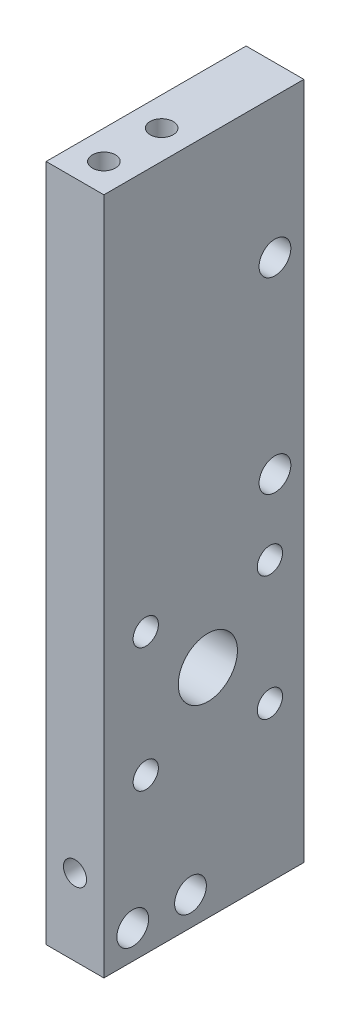
from build123d import *

# Parameters (mm, degrees)
MAIN_STOCK_START                  = 2.248090434
SKETCH_1_W                        = 4
SKETCH_1_H                        = 46.98
MAIN_STOCK_DEPTH                  = 8.851909566
SKETCH_2_R                        = 0.8
FRAME_1XD1P6_THROUGH_DEPTH        = 44.799871038
SKETCH_3_R                        = 2.05
SMA_CENTER_D4P1_DEPTH             = 4
SKETCH_4_R                        = 0.875
SMA_UPPER_2XD1P75_THROUGH_DEPTH   = 45.280835584
SKETCH_5_R                        = 1.1
CORNER_FRONT_2XD2P2_THROUGH_DEPTH = 45.280835584
SKETCH_6_R                        = 0.8
CORNER_REAR_2XD1P6_BLIND4_DEPTH   = 4
SKETCH_7_W                        = 4
SKETCH_7_H                        = 46.98
WALL_EXTENSION_TO_FLOOR_DEPTH     = 5
SKETCH_8_R                        = 2.05
SMA_CENTER_FULL_BORE_DEPTH        = 4.01
SKETCH_9_R                        = 0.875
SMA_LOWER_M2P2_THROUGH_DEPTH      = 4.01
SKETCH_10_R                       = 1.1
HORIZONTAL_BASE_M2_0_0_0043_DEPTH = 4.01


with BuildPart() as part:
    # 草图1 → Main_Stock (new body)
    with BuildSketch(Plane.XY.offset(MAIN_STOCK_START)):
        with Locations((-2.3, 19.19)):
            Rectangle(SKETCH_1_W, SKETCH_1_H)
    extrude(amount=MAIN_STOCK_DEPTH)

    # 草图2 → Frame_1xD1p6_Through (cut, through all)
    with BuildSketch(Plane.XY.offset(11.1)):
        with Locations((-2.3, 1)):
            Circle(SKETCH_2_R)
    extrude(amount=-FRAME_1XD1P6_THROUGH_DEPTH, mode=Mode.SUBTRACT)

    # 草图3 → SMA_Center_D4p1 (cut)
    with BuildSketch(Plane.ZY.offset(4.3)):
        with Locations((3.899496327, 10.725)):
            Circle(SKETCH_3_R)
    extrude(amount=-SMA_CENTER_D4P1_DEPTH, mode=Mode.SUBTRACT)

    # 草图4 → SMA_Upper_2xD1p75_Through (cut, through all)
    with BuildSketch(Plane.ZY.offset(4.3)):
        with Locations((8.199496327, 6.425)):
            Circle(SKETCH_4_R)
        with Locations((8.199496327, 15.025)):
            Circle(SKETCH_4_R)
    extrude(amount=-SMA_UPPER_2XD1P75_THROUGH_DEPTH, mode=Mode.SUBTRACT)

    # 草图5 → Corner_Front_2xD2p2_Through (cut, through all)
    with BuildSketch(Plane.ZY.offset(4.3)):
        with Locations((5.1, -2.3)):
            Circle(SKETCH_5_R)
        with Locations((9.1, -2.3)):
            Circle(SKETCH_5_R)
    extrude(amount=-CORNER_FRONT_2XD2P2_THROUGH_DEPTH, mode=Mode.SUBTRACT)

    # 草图6 → Corner_Rear_2xD1p6_Blind4 (cut)
    with BuildSketch(Plane(origin=(0, 42.68, 0), x_dir=(1, 0, 0), z_dir=(0, 1, 0))):
        with Locations((-2.3, -5.1)):
            Circle(SKETCH_6_R)
        with Locations((-2.3, -9.1)):
            Circle(SKETCH_6_R)
    extrude(amount=-CORNER_REAR_2XD1P6_BLIND4_DEPTH, mode=Mode.SUBTRACT)

    # 草图7 → Wall_Extension_To_Floor (add)
    with BuildSketch(Plane(origin=(0, 0, 2.248090434), x_dir=(-1, 0, 0), z_dir=(0, 0, -1))):
        with Locations((2.3, 19.19)):
            Rectangle(SKETCH_7_W, SKETCH_7_H)
    extrude(amount=WALL_EXTENSION_TO_FLOOR_DEPTH)

    # 草图8 → SMA_Center_Full_Bore (cut)
    with BuildSketch(Plane.ZY.offset(4.3)):
        with Locations((3.899496327, 10.725)):
            Circle(SKETCH_8_R)
    extrude(amount=-SMA_CENTER_FULL_BORE_DEPTH, mode=Mode.SUBTRACT)

    # 草图9 → SMA_Lower_M2p2_Through (cut)
    with BuildSketch(Plane.ZY.offset(4.3)):
        with Locations((-0.400503673, 6.425)):
            Circle(SKETCH_9_R)
        with Locations((-0.400503673, 15.025)):
            Circle(SKETCH_9_R)
    extrude(amount=-SMA_LOWER_M2P2_THROUGH_DEPTH, mode=Mode.SUBTRACT)

    # 草图10 → Horizontal_Base_M2_0_-0.0043 (cut)
    with BuildSketch(Plane.ZY.offset(4.3)):
        with Locations((-0.75, 20)):
            Circle(SKETCH_10_R)
        with Locations((-0.75, 33)):
            Circle(SKETCH_10_R)
    extrude(amount=-HORIZONTAL_BASE_M2_0_0_0043_DEPTH, mode=Mode.SUBTRACT)


solid = part.part
